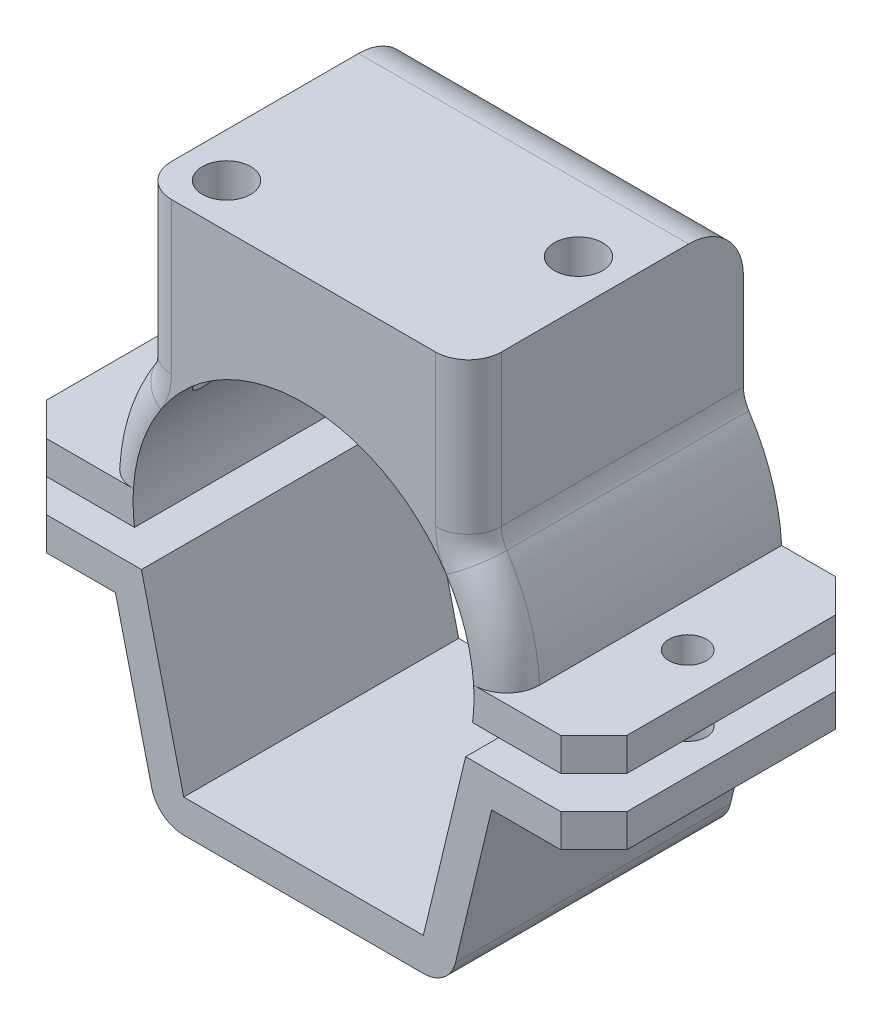
from build123d import *

# Parameters (mm, degrees)
BOSS_EXTRUDE1_DEPTH     = 12.5
BOSS_EXTRUDE1_2_DEPTH   = 12.5
BOSS_EXTRUDE4_START     = -12.5
SKETCH9_W               = 9.28823465
SKETCH9_H               = 3
BOSS_EXTRUDE4_DEPTH     = 25
M3_CLEARANCE_HOLE1_D    = 3.4
CHAMFER1_SIZE           = 3
CHAMFER2_SIZE           = 3
FILLET1_R               = 3
FILLET2_R               = 3
CUT_EXTRUDE1_REACH      = 59.472
CUT_EXTRUDE1_END_RADIUS = 15.5
SKETCH15_R              = 2.2
FILLET3_R               = 5
FILLET4_R               = 3


with BuildPart() as part:
    # Sketch2 → Boss-Extrude1 (new, symmetric)
    with BuildSketch(Plane.XY):
        Polygon((-10.894064201, -21), (-14.73836373, -5.005423315), (-17.823799504, -5.005423315), (-13.258449409, -24), (13.258449409, -24), (17.823799504, -5.005423315), (14.73836373, -5.005423315), (10.894064201, -21), align=None)
    extrude(amount=BOSS_EXTRUDE1_DEPTH, both=True)



with BuildPart() as body_2:
    # Sketch2 → Boss-Extrude1 2 (new, symmetric)
    with BuildSketch(Plane.XY):
        with BuildLine():
            Line((-18.390983588, -2.005423315), (-15.369719494, -2.005423315))
            ThreePointArc((-15.369719494, -2.005423315), (0, 15.5), (15.369719494, -2.005423315))
            Line((15.369719494, -2.005423315), (18.390983588, -2.005423315))
            ThreePointArc((18.390983588, -2.005423315), (17.886166252, 4.725997968), (15, 10.828203914))
            Line((15, 10.828203914), (15, 25.5))
            Line((15, 25.5), (-15, 25.5))
            Line((-15, 25.5), (-15, 10.828203914))
            ThreePointArc((-15, 10.828203914), (-17.886166252, 4.725997968), (-18.390983588, -2.005423315))
        make_face()
    extrude(amount=BOSS_EXTRUDE1_2_DEPTH, both=True)


with BuildPart() as part_1:
    add(part.part)

    add(body_2.part)  # Boss-Extrude4 merges body 2
    # Sketch9 → Boss-Extrude4 (add)
    with BuildSketch(Plane.XY.offset(BOSS_EXTRUDE4_START)):
        with Locations((21.746866263, -0.505423315)):
            Rectangle(SKETCH9_W, SKETCH9_H)
        with Locations((21.746866263, -6.505423315)):
            Rectangle(SKETCH9_W, SKETCH9_H)
        with Locations((-21.746866263, -0.505423315)):
            Rectangle(SKETCH9_W, SKETCH9_H)
        with Locations((-21.746866263, -6.505423315)):
            Rectangle(SKETCH9_W, SKETCH9_H)
    extrude(amount=BOSS_EXTRUDE4_DEPTH)

    # M3 Clearance Hole1 (through all)
    with Locations(Plane(origin=(0, 0.994576685, 0), x_dir=(1, 0, 0), z_dir=(0, 1, 0))):
        with Locations((-22.432114786, 0), (22.432114786, 0)):
            Hole(M3_CLEARANCE_HOLE1_D / 2)

    # Chamfer1
    chamfer1_edges = [part_1.edges().sort_by_distance(p)[0] for p in [
        (26.390983588, -0.505423315, 12.5),
        (26.390983588, -0.505423315, -12.5),
        (-26.390983588, -0.505423315, 12.5),
        (-26.390983588, -0.505423315, -12.5),
    ]]
    chamfer(chamfer1_edges, length=CHAMFER1_SIZE)

    # Chamfer2
    chamfer2_edges = [part_1.edges().sort_by_distance(p)[0] for p in [
        (26.390983588, -6.505423315, 12.5),
        (26.390983588, -6.505423315, -12.5),
        (-26.390983588, -6.505423315, 12.5),
        (-26.390983588, -6.505423315, -12.5),
    ]]
    chamfer(chamfer2_edges, length=CHAMFER2_SIZE)

    # Fillet1
    fillet1_edges = [part_1.edges().sort_by_distance(p)[0] for p in [
        (13.258449409, -24, 0),
        (-13.258449409, -24, 0),
    ]]
    fillet(fillet1_edges, radius=FILLET1_R)

    # Fillet2
    fillet2_edges = [part_1.edges().sort_by_distance(p)[0] for p in [
        (15, 10.828203914, 0),
        (-15, 10.828203914, 0),
    ]]
    fillet(fillet2_edges, radius=FILLET2_R)

    # Cut-Extrude1: up to this cylinder (the profile starts outside it)
    cut_extrude1_end = Plane(origin=(0, 0, 3.5), z_dir=(0, 0, -1)) * Cylinder(CUT_EXTRUDE1_END_RADIUS, 160.944, mode=Mode.PRIVATE)
    # Sketch15 → Cut-Extrude1 (cut, up to the surface)
    with BuildSketch(Plane(origin=(0, 25.5, 0), x_dir=(1, 0, 0), z_dir=(0, 1, 0)), mode=Mode.PRIVATE) as cut_extrude1_sk1:
        with Locations(Location((-11, -8.5, 0), (0, 0, 270))):
            Circle(SKETCH15_R)
    cut_extrude1_tool1 = extrude(cut_extrude1_sk1.sketch, amount=-CUT_EXTRUDE1_REACH, mode=Mode.PRIVATE) - cut_extrude1_end
    add(cut_extrude1_tool1.solids().sort_by_distance((-11, 25.5, 8.5))[0], mode=Mode.SUBTRACT)
    # Sketch15 → Cut-Extrude1 (cut, up to the surface)
    with BuildSketch(Plane(origin=(0, 25.5, 0), x_dir=(1, 0, 0), z_dir=(0, 1, 0)), mode=Mode.PRIVATE) as cut_extrude1_sk2:
        with Locations(Location((11, 1.5, 0), (0, 0, 270))):
            Circle(SKETCH15_R)
    cut_extrude1_tool2 = extrude(cut_extrude1_sk2.sketch, amount=-CUT_EXTRUDE1_REACH, mode=Mode.PRIVATE) - cut_extrude1_end
    add(cut_extrude1_tool2.solids().sort_by_distance((11, 25.5, -1.5))[0], mode=Mode.SUBTRACT)

    # Fillet3
    fillet3_edges = [part_1.edges().sort_by_distance(p)[0] for p in [
        (0, 25.5, -12.5),
    ]]
    fillet(fillet3_edges, radius=FILLET3_R)

    # Fillet4
    fillet4_edges = [part_1.edges().sort_by_distance(p)[0] for p in [
        (-17.582776357, 5.752910183, 12.5),
        (15.124684042, 10.902079913, 12.5),
        (-15.124684042, 10.902079913, 12.5),
        (17.582776357, 5.752910183, 12.5),
        (15, 18.628988008, 12.5),
        (-15, 18.628988008, 12.5),
    ]]
    fillet(fillet4_edges, radius=FILLET4_R - 0.0001)  # a hair under: the kernel refuses the full size


solid = part_1.part
